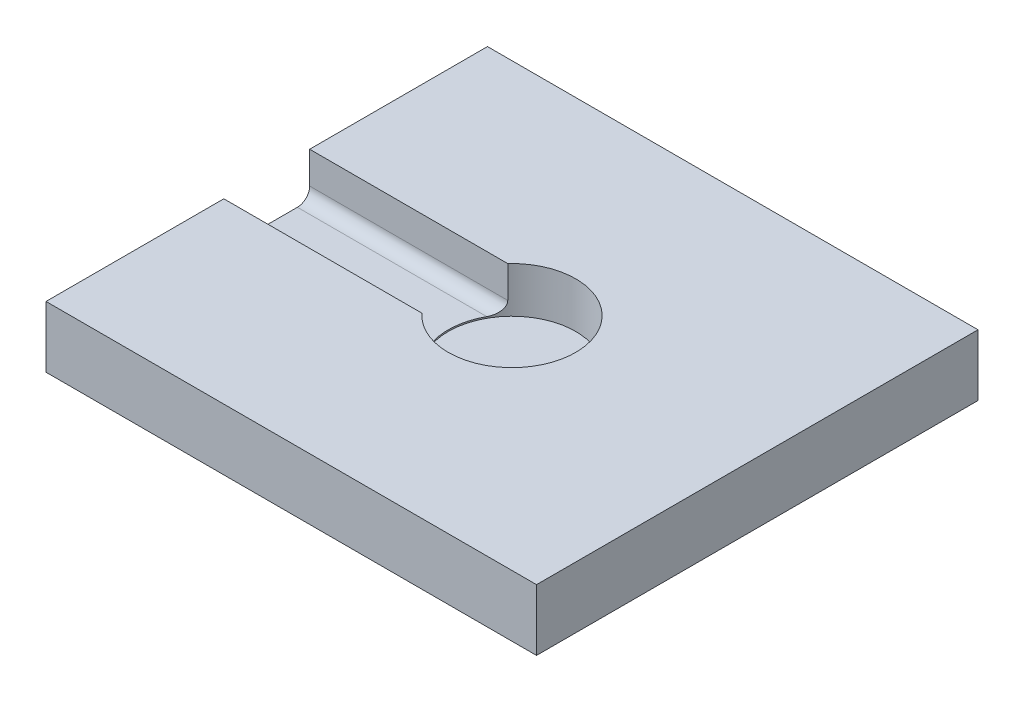
from build123d import *

# Parameters (mm, degrees)
SKETCH1_W           = 200
SKETCH1_H           = 180
BASE_DEPTH          = 25
SKETCH2_R           = 26
LOAD_CELL_CUT_DEPTH = 18.6
WIRE_CUT_REACH      = 222.737
SKETCH3_W           = 35
SKETCH3_H           = 18
WIRE_CUT_FILLET_R   = 5


with BuildPart() as part:
    # Sketch1 → base (new body)
    with BuildSketch(Plane(origin=(0, 0, 0), x_dir=(1, 0, 0), z_dir=(0, 1, 0))):
        Rectangle(SKETCH1_W, SKETCH1_H)
    extrude(amount=BASE_DEPTH)

    # Sketch2 → load cell cut (cut)
    with BuildSketch(Plane(origin=(0, 25, 0), x_dir=(1, 0, 0), z_dir=(0, 1, 0))):
        Circle(SKETCH2_R)
    extrude(amount=-LOAD_CELL_CUT_DEPTH, mode=Mode.SUBTRACT)

    # Sketch3 → wire cut (cut, up to next)
    with BuildSketch(Plane(origin=(-100, 0, 0), x_dir=(0, 0, -1), z_dir=(1, 0, 0)), mode=Mode.PRIVATE) as wire_cut_sk1:
        with Locations((0, 16)):
            Rectangle(SKETCH3_W, SKETCH3_H)
    wire_cut_tool1 = extrude(wire_cut_sk1.sketch, amount=WIRE_CUT_REACH, mode=Mode.PRIVATE) & part.part
    add(wire_cut_tool1.solids().sort_by_distance((-100, 16, 0))[0], mode=Mode.SUBTRACT)

    # wire cut fillet
    wire_cut_fillet_edges = [part.edges().sort_by_distance(p)[0] for p in [
        (-59.614442262, 7, 17.5),
        (-59.614442262, 7, -17.5),
    ]]
    fillet(wire_cut_fillet_edges, radius=WIRE_CUT_FILLET_R)


solid = part.part
